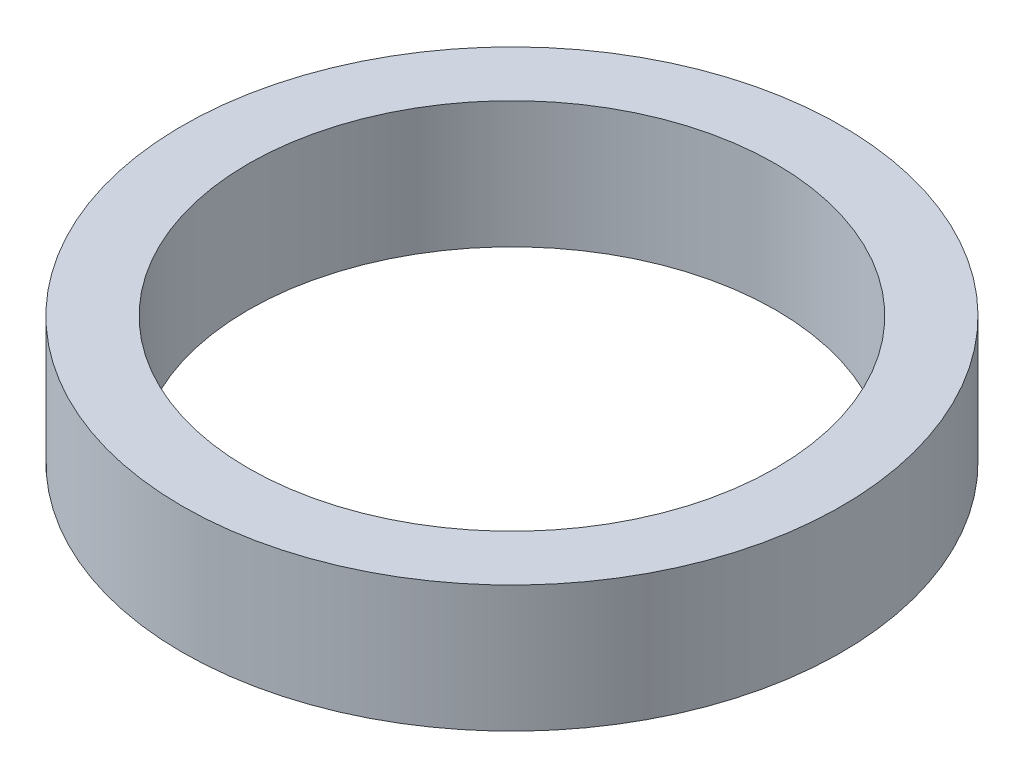
from build123d import *

# Parameters (mm, degrees)
SKETCH1_R           = 62.5
BOSS_EXTRUDE1_DEPTH = 24
SKETCH2_R           = 50
CUT_EXTRUDE1_DEPTH  = 92.588754768


with BuildPart() as part:
    # Sketch1 → Boss-Extrude1 (new body)
    with BuildSketch(Plane(origin=(0, 0, 0), x_dir=(1, 0, 0), z_dir=(0, 1, 0))):
        Circle(SKETCH1_R)
    extrude(amount=BOSS_EXTRUDE1_DEPTH)

    # Sketch2 → Cut-Extrude1 (cut, through all)
    with BuildSketch(Plane(origin=(0, 0, 0), x_dir=(1, 0, 0), z_dir=(0, 1, 0))):
        Circle(SKETCH2_R)
    extrude(amount=CUT_EXTRUDE1_DEPTH, mode=Mode.SUBTRACT)


solid = part.part
